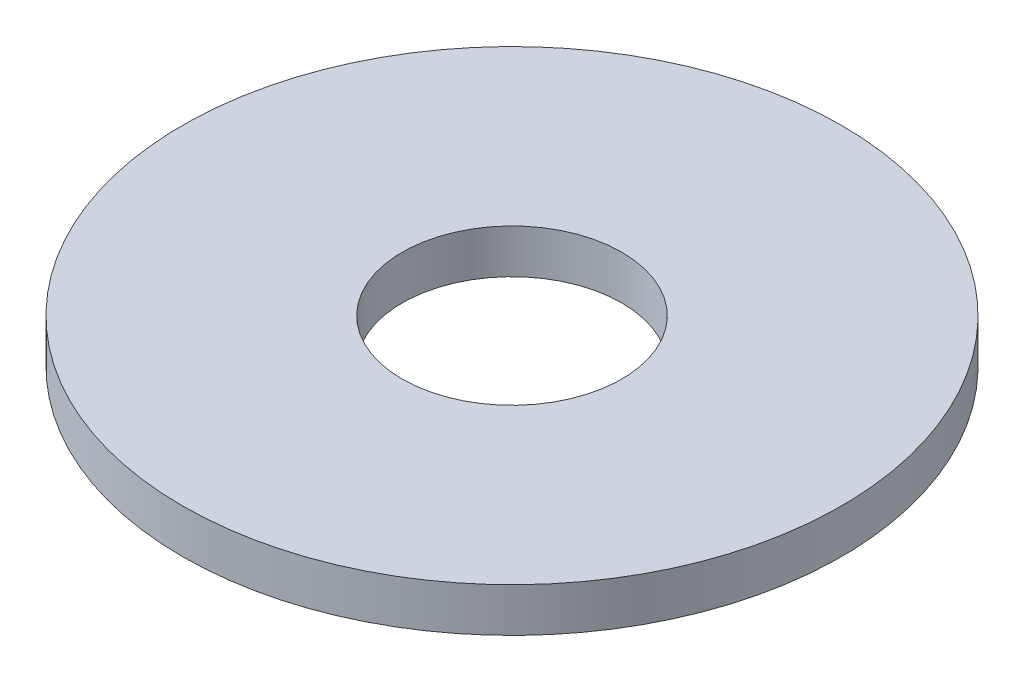
from build123d import *

# Parameters (mm, degrees)
SKETCH1_R           = 9.525
SKETCH1_R_2         = 3.175
BOSS_EXTRUDE1_DEPTH = 1.27


with BuildPart() as part:
    # Sketch1 → Boss-Extrude1 (new body)
    with BuildSketch(Plane(origin=(0, 0, 0), x_dir=(1, 0, 0), z_dir=(0, 1, 0))):
        Circle(SKETCH1_R)
        Circle(SKETCH1_R_2, mode=Mode.SUBTRACT)
    extrude(amount=BOSS_EXTRUDE1_DEPTH)


solid = part.part
